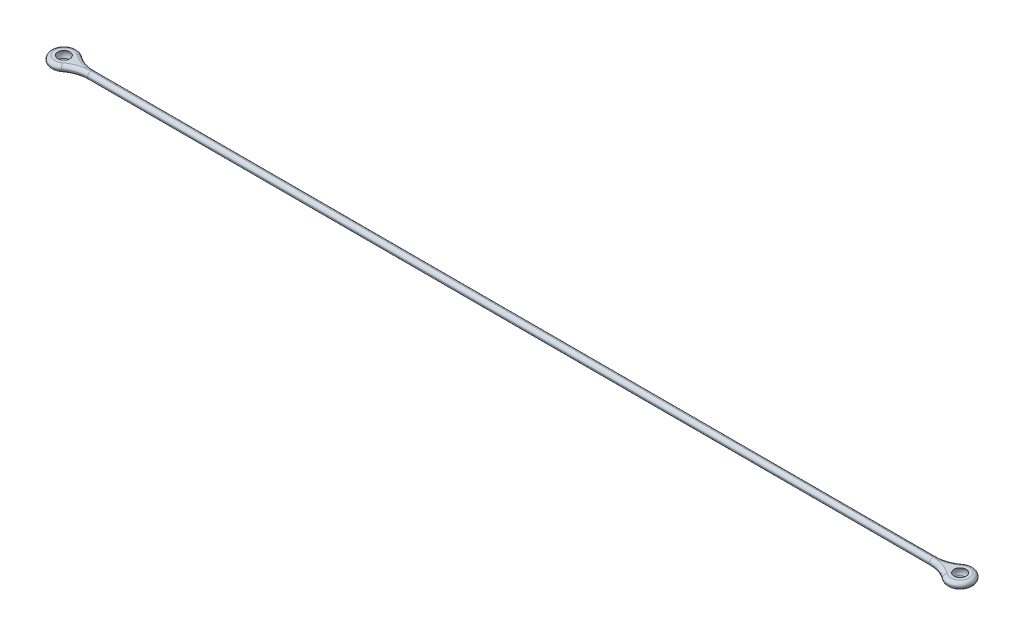
from build123d import *
from build123d.topology import SkipClean

# Parameters (mm, degrees)
BOSS_EXTRUDE1_DEPTH      = 0.75
BOSS_EXTRUDE1_DEPTH_BACK = 0.75
FILLET1_R                = 0.75


with BuildPart() as part:
    # Sketch1 → Boss-Extrude1 (new, two sides: drawn at the far end of the back side and taken through both)
    with BuildSketch(Plane(origin=(0, 0, 0), x_dir=(1, 0, 0), z_dir=(0, 1, 0)).offset(-BOSS_EXTRUDE1_DEPTH_BACK)):
        with BuildLine():
            ThreePointArc((-95.482480689, 2.181395213), (-99.907, 0), (-95.482480689, -2.181395213))
            ThreePointArc((-95.482480689, -2.181395213), (-93.492976652, -1.117609047), (-91.26707663, -0.75))
            Line((-91.26707663, -0.75), (91.26707663, -0.75))
            ThreePointArc((91.26707663, -0.75), (93.492976652, -1.117609047), (95.482480689, -2.181395213))
            ThreePointArc((95.482480689, -2.181395213), (99.907, 0), (95.482480689, 2.181395213))
            ThreePointArc((95.482480689, 2.181395213), (93.492976652, 1.117609047), (91.26707663, 0.75))
            Line((91.26707663, 0.75), (-91.26707663, 0.75))
            ThreePointArc((-91.26707663, 0.75), (-93.492976652, 1.117609047), (-95.482480689, 2.181395213))
        make_face()
    extrude(amount=BOSS_EXTRUDE1_DEPTH + BOSS_EXTRUDE1_DEPTH_BACK)

    # Sketch1<3> → Cut-Revolve1 (revolve, cut)
    with SkipClean():  # the faces are left unmerged after this step: merging them gives an invalid solid
        with BuildSketch(Plane(origin=(0, 0, 0), x_dir=(1, 0, 0), z_dir=(0, 1, 0))):
            with BuildLine():
                ThreePointArc((-95.657, 0), (-97.157, 1.5), (-98.657, 0))
                Line((-98.657, 0), (-95.657, 0))
            make_face()
            with BuildLine():
                Line((-95.657, 0), (-98.657, 0))
                ThreePointArc((-98.657, 0), (-97.157, -1.5), (-95.657, 0))
            make_face()
            with BuildLine():
                ThreePointArc((98.657, 0), (97.157, 1.5), (95.657, 0))
                Line((95.657, 0), (98.657, 0))
            make_face()
            with BuildLine():
                Line((98.657, 0), (95.657, 0))
                ThreePointArc((95.657, 0), (97.157, -1.5), (98.657, 0))
            make_face()
        revolve(axis=Axis((-97.157, 0, 0), (1, 0, 0)), mode=Mode.SUBTRACT)
    add(part.part.scale(1), mode=Mode.REPLACE)  # the faces are merged on a copy

    # Fillet1
    fillet1_edges = [part.edges().sort_by_distance(p)[0] for p in [
        (-93.492976652, -0.75, 1.117609047),
        (-99.907, -0.75, 0),
        (-93.492976652, -0.75, -1.117609047),
        (0, -0.75, -0.75),
        (93.492976652, -0.75, -1.117609047),
        (99.907, -0.75, 0),
        (93.492976652, -0.75, 1.117609047),
        (-93.492976652, 0.75, 1.117609047),
        (-99.907, 0.75, 0),
        (-93.492976652, 0.75, -1.117609047),
        (0, 0.75, -0.75),
        (93.492976652, 0.75, -1.117609047),
        (99.907, 0.75, 0),
        (93.492976652, 0.75, 1.117609047),
        (0, -0.75, 0.75),
        (0, 0.75, 0.75),
    ]]
    fillet(fillet1_edges, radius=FILLET1_R - 0.0001)  # a hair under: the kernel refuses the full size


solid = part.part
